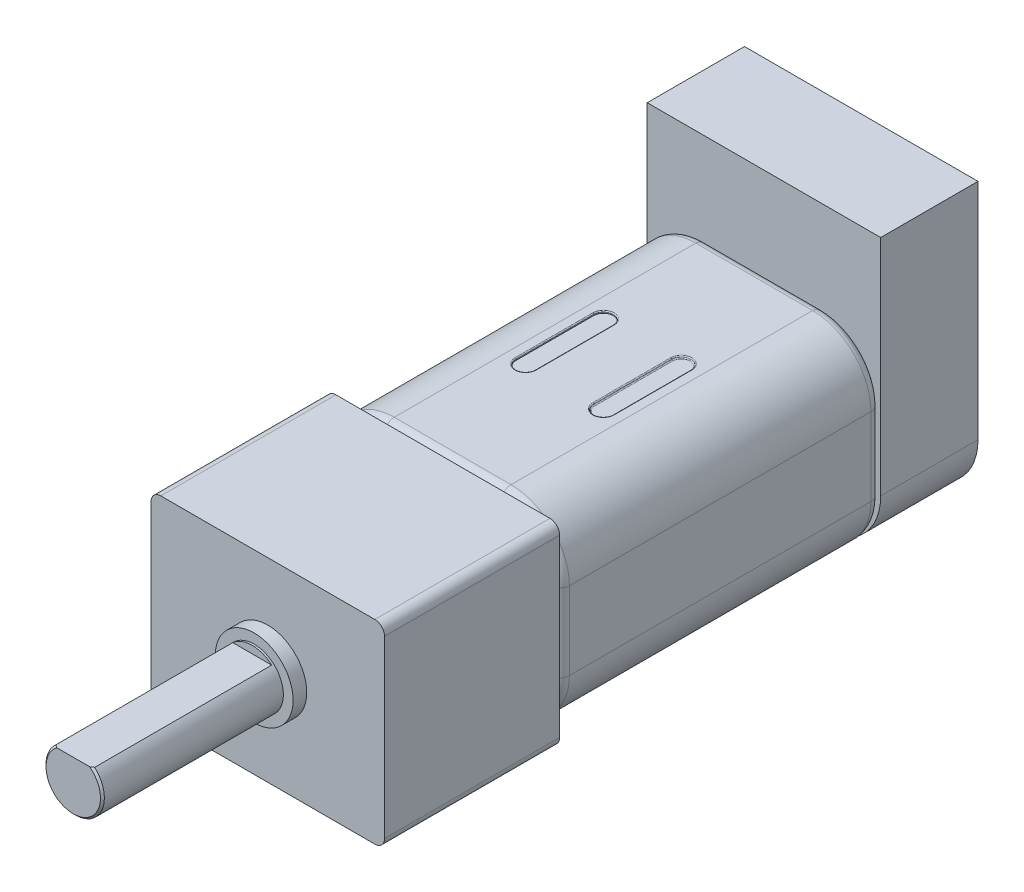
from build123d import *

# Parameters (mm, degrees)
BOSS_EXTRU_1_DEPTH      = 9
ESQUISSE2_R             = 2
BOSS_EXTRU_2_DEPTH      = 0.7
ESQUISSE3_R             = 1.5
BOSS_EXTRU_3_DEPTH      = 0.1
BOSS_EXTRU_4_DEPTH      = 9.2
CHANFREIN1_SIZE         = 0.1
BOSS_EXTRU_5_DEPTH      = 16.5
ESQUISSE6_W             = 12
ESQUISSE6_H             = 5
BOSS_EXTRU_6_DEPTH      = 14.5
CONG_1_R                = 3
ENL_V_MAT_EXTRU_1_DEPTH = 0.1
ENL_V_MAT_EXTRU_2_DEPTH = 0.1
CONG_2_R                = 0.05
CONG_3_R                = 0.5


with BuildPart() as part:
    # Esquisse1 → Boss.-Extru.1 (new body)
    with BuildSketch(Plane.XY):
        with BuildLine():
            Line((-5.5, 5), (5.5, 5))
            ThreePointArc((5.5, 5), (5.853553391, 4.853553391), (6, 4.5))
            Line((6, 4.5), (6, -4.5))
            ThreePointArc((6, -4.5), (5.853553391, -4.853553391), (5.5, -5))
            Line((5.5, -5), (-5.5, -5))
            ThreePointArc((-5.5, -5), (-5.853553391, -4.853553391), (-6, -4.5))
            Line((-6, -4.5), (-6, 4.5))
            ThreePointArc((-6, 4.5), (-5.853553391, 4.853553391), (-5.5, 5))
        make_face()
    extrude(amount=-BOSS_EXTRU_1_DEPTH)

    # Esquisse2 → Boss.-Extru.2 (add)
    with BuildSketch(Plane.XY):
        Circle(ESQUISSE2_R)
    extrude(amount=BOSS_EXTRU_2_DEPTH)

    # Esquisse3 → Boss.-Extru.3 (add)
    with BuildSketch(Plane.XY.offset(0.7)):
        Circle(ESQUISSE3_R)
    extrude(amount=BOSS_EXTRU_3_DEPTH)

    # Esquisse4 → Boss.-Extru.4 (add)
    with BuildSketch(Plane.XY.offset(0.8)):
        with BuildLine():
            Line((1, 1.118033989), (-1, 1.118033989))
            ThreePointArc((-1, 1.118033989), (0, -1.5), (1, 1.118033989))
        make_face()
    extrude(amount=BOSS_EXTRU_4_DEPTH)

    # Chanfrein1
    chanfrein1_edges = [part.edges().sort_by_distance(p)[0] for p in [
        (0, -1.5, 10),
    ]]
    chamfer(chanfrein1_edges, length=CHANFREIN1_SIZE)


with BuildPart() as body_2:
    # Esquisse5 → Boss.-Extru.5 (new body)
    with BuildSketch(Plane(origin=(0, 0, -9), x_dir=(-1, 0, 0), z_dir=(0, 0, -1))):
        with BuildLine():
            Line((-3, 5), (3, 5))
            ThreePointArc((3, 5), (5.121320344, 4.121320344), (6, 2))
            Line((6, 2), (6, -2))
            ThreePointArc((6, -2), (5.121320344, -4.121320344), (3, -5))
            Line((3, -5), (-3, -5))
            ThreePointArc((-3, -5), (-5.121320344, -4.121320344), (-6, -2))
            Line((-6, -2), (-6, 2))
            ThreePointArc((-6, 2), (-5.121320344, 4.121320344), (-3, 5))
        make_face()
    extrude(amount=BOSS_EXTRU_5_DEPTH)

    # Esquisse7 → Enlèv. mat.-Extru.1 (cut)
    with BuildSketch(Plane(origin=(0, 5, 0), x_dir=(1, 0, 0), z_dir=(0, 1, 0))):
        with BuildLine():
            Line((-1.5, 19.25), (-1.5, 15.25))
            ThreePointArc((-1.5, 15.25), (-2, 14.75), (-2.5, 15.25))
            Line((-2.5, 15.25), (-2.5, 19.25))
            ThreePointArc((-2.5, 19.25), (-2, 19.75), (-1.5, 19.25))
        make_face()
        with BuildLine():
            Line((2.5, 19.25), (2.5, 15.25))
            ThreePointArc((2.5, 15.25), (2, 14.75), (1.5, 15.25))
            Line((1.5, 15.25), (1.5, 19.25))
            ThreePointArc((1.5, 19.25), (2, 19.75), (2.5, 19.25))
        make_face()
    extrude(amount=-ENL_V_MAT_EXTRU_1_DEPTH, mode=Mode.SUBTRACT)

    # Esquisse8 → Enlèv. mat.-Extru.2 (cut)
    with BuildSketch(Plane(origin=(0, -5, 0), x_dir=(-1, 0, 0), z_dir=(0, -1, 0))):
        with BuildLine():
            Line((-1.5, 19.25), (-1.5, 15.25))
            ThreePointArc((-1.5, 15.25), (-2, 14.75), (-2.5, 15.25))
            Line((-2.5, 15.25), (-2.5, 19.25))
            ThreePointArc((-2.5, 19.25), (-2, 19.75), (-1.5, 19.25))
        make_face()
        with BuildLine():
            Line((2.5, 19.25), (2.5, 15.25))
            ThreePointArc((2.5, 15.25), (2, 14.75), (1.5, 15.25))
            Line((1.5, 15.25), (1.5, 19.25))
            ThreePointArc((1.5, 19.25), (2, 19.75), (2.5, 19.25))
        make_face()
    extrude(amount=-ENL_V_MAT_EXTRU_2_DEPTH, mode=Mode.SUBTRACT)

    # Congé2
    cong_2_edges = [body_2.edges().sort_by_distance(p)[0] for p in [
        (-2, 5, -19.75),
        (-2.5, 5, -17.25),
        (-2, 5, -14.75),
        (-1.5, 5, -17.25),
        (2, 4.9, -19.75),
        (2.5, 4.9, -17.25),
        (2, 4.9, -14.75),
        (1.5, 4.9, -17.25),
        (2, 5, -19.75),
        (1.5, 5, -17.25),
        (2, 5, -14.75),
        (2.5, 5, -17.25),
        (2, -5, -19.75),
        (2.5, -5, -17.25),
        (2, -5, -14.75),
        (1.5, -5, -17.25),
        (-2, -5, -19.75),
        (-1.5, -5, -17.25),
        (-2, -5, -14.75),
        (-2.5, -5, -17.25),
    ]]
    fillet(cong_2_edges, radius=CONG_2_R - 0.0001)  # a hair under: the kernel refuses the full size

    # Congé3
    cong_3_edges = [body_2.edges().sort_by_distance(p)[0] for p in [
        (-6, 0, -9),
        (-5.121320344, -4.121320344, -9),
        (0, -5, -9),
        (5.121320344, -4.121320344, -9),
        (-5.121320344, -4.121320344, -25.5),
        (-6, 0, -25.5),
        (-5.121320344, 4.121320344, -25.5),
        (0, 5, -25.5),
        (5.121320344, 4.121320344, -25.5),
        (6, 0, -25.5),
        (5.121320344, -4.121320344, -25.5),
        (6, 0, -9),
        (0, -5, -25.5),
        (5.121320344, 4.121320344, -9),
        (0, 5, -9),
        (-5.121320344, 4.121320344, -9),
    ]]
    fillet(cong_3_edges, radius=CONG_3_R)


with BuildPart() as body_3:
    # Esquisse6 → Boss.-Extru.6 (new body)
    with BuildSketch(Plane.XZ.offset(5)):
        with Locations((0, -28)):
            Rectangle(ESQUISSE6_W, ESQUISSE6_H)
    extrude(amount=-BOSS_EXTRU_6_DEPTH)

    # Congé1
    cong_1_edges = [body_3.edges().sort_by_distance(p)[0] for p in [
        (6, -5, -28),
        (-6, -5, -28),
    ]]
    fillet(cong_1_edges, radius=CONG_1_R)


solid = Compound([part.part, body_2.part, body_3.part])
